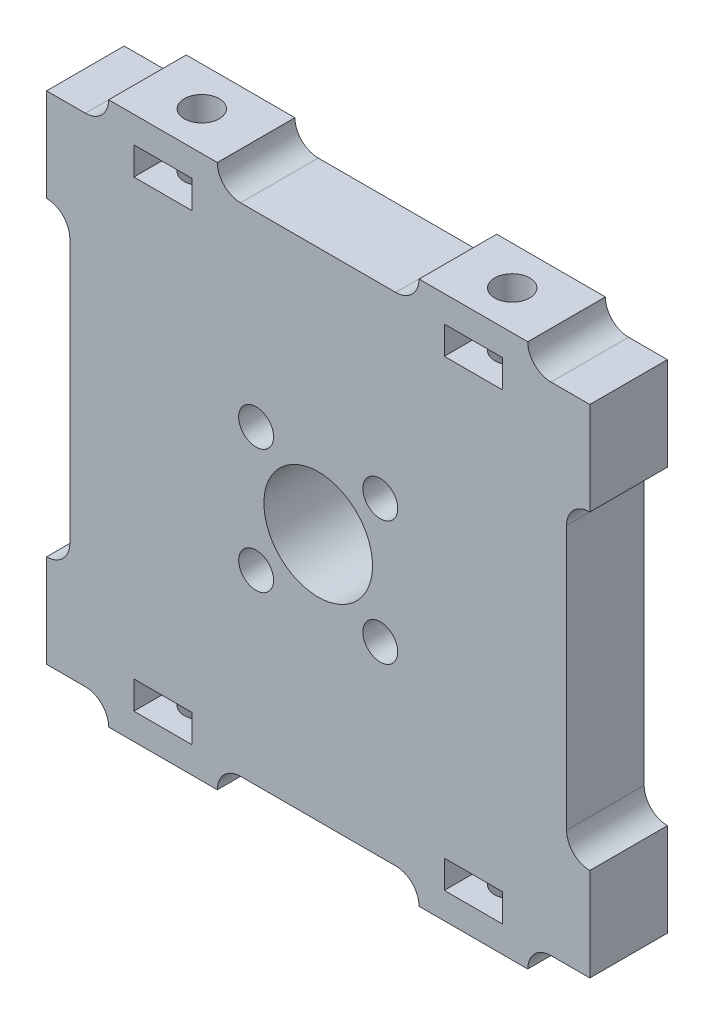
from build123d import *

# Parameters (mm, degrees)
CROQUIS1_W              = 70
CROQUIS1_H              = 70
CROQUIS1_R              = 7
SALIENTE_EXTRUIR1_DEPTH = 5
CROQUIS2_R              = 2.25
CROQUIS2_W              = 26
CROQUIS2_H              = 6
CROQUIS2_W_2            = 6
CROQUIS2_H_2            = 26
CORTAR_EXTRUIR1_DEPTH   = 51.497524692
CROQUIS4_R              = 2.25
CORTAR_EXTRUIR2_DEPTH   = 10
CORTAR_EXTRUIR3_DEPTH   = 3.6
CROQUIS6_W              = 8
CROQUIS6_H              = 3
CROQUIS6_W_2            = 6
CROQUIS6_H_2            = 40
CORTAR_EXTRUIR4_DEPTH   = 51.497524692
REDONDEO1_R             = 3


with BuildPart() as part:
    # Croquis1 → Saliente-Extruir1 (new, symmetric)
    with BuildSketch(Plane.XY):
        Rectangle(CROQUIS1_W, CROQUIS1_H)
        Circle(CROQUIS1_R, mode=Mode.SUBTRACT)
    extrude(amount=SALIENTE_EXTRUIR1_DEPTH, both=True)

    # Croquis2 → Cortar-Extruir1 (cut, through all)
    with BuildSketch(Plane.XY.offset(5)):
        with Locations((8, 8)):
            Circle(CROQUIS2_R)
        with Locations((8, -8)):
            Circle(CROQUIS2_R)
        with Locations((-8, -8)):
            Circle(CROQUIS2_R)
        with Locations((-8, 8)):
            Circle(CROQUIS2_R)
        with Locations((0, 35)):
            Rectangle(CROQUIS2_W, CROQUIS2_H)
        with Locations((-35, 0)):
            Rectangle(CROQUIS2_W_2, CROQUIS2_H_2)
        with Locations((35, 0)):
            Rectangle(CROQUIS2_W_2, CROQUIS2_H_2)
        with Locations((0, -35)):
            Rectangle(CROQUIS2_W, CROQUIS2_H)
    extrude(amount=-CORTAR_EXTRUIR1_DEPTH, mode=Mode.SUBTRACT)

    # Croquis4 → Cortar-Extruir2 (cut)
    with BuildSketch(Plane(origin=(0, 35, 0), x_dir=(1, 0, 0), z_dir=(0, 1, 0))):
        with Locations(Location((-20, 0, 0), (0, 0, 270))):
            Circle(CROQUIS4_R)
        with Locations(Location((20, 0, 0), (0, 0, 270))):
            Circle(CROQUIS4_R)
    cortar_extruir2 = extrude(amount=-CORTAR_EXTRUIR2_DEPTH, mode=Mode.SUBTRACT)

    # Croquis5 → Cortar-Extruir3 (cut)
    with BuildSketch(Plane(origin=(0, 28, 0), x_dir=(1, 0, 0), z_dir=(0, 1, 0))):
        Polygon((-23.75, -2.165063509), (-23.75, -5), (-16.25, -5), (-16.25, -2.165063509), (-16.25, 2.165063509), (-20, 4.330127019), (-23.75, 2.165063509), align=None)
        Polygon((16.25, 2.165063509), (16.25, -2.165063509), (16.25, -5), (23.75, -5), (23.75, -2.165063509), (23.75, 2.165063509), (20, 4.330127019), align=None)
    cortar_extruir3 = extrude(amount=CORTAR_EXTRUIR3_DEPTH, mode=Mode.SUBTRACT)

    # Simetría1: Cortar-Extruir2, Cortar-Extruir3 across plane
    add(cortar_extruir2.mirror(Plane.ZX), mode=Mode.SUBTRACT)
    add(cortar_extruir3.mirror(Plane.ZX), mode=Mode.SUBTRACT)

    # Croquis6 → Cortar-Extruir4 (cut, through all)
    with BuildSketch(Plane.XY.offset(5)):
        with Locations((-31, 33.5)):
            Rectangle(CROQUIS6_W, CROQUIS6_H)
        with Locations((31, 33.5)):
            Rectangle(CROQUIS6_W, CROQUIS6_H)
        with Locations((31, -33.5)):
            Rectangle(CROQUIS6_W, CROQUIS6_H)
        with Locations((-31, -33.5)):
            Rectangle(CROQUIS6_W, CROQUIS6_H)
        with Locations((-35, 0)):
            Rectangle(CROQUIS6_W_2, CROQUIS6_H_2)
        with Locations((35, 0)):
            Rectangle(CROQUIS6_W_2, CROQUIS6_H_2)
    extrude(amount=-CORTAR_EXTRUIR4_DEPTH, mode=Mode.SUBTRACT)

    # Redondeo1
    redondeo1_edges = [part.edges().sort_by_distance(p)[0] for p in [
        (27, -32, 0),
        (13, -32, 0),
        (-13, -32, 0),
        (-27, -32, 0),
        (-32, -20, 0),
        (-32, 20, 0),
        (32, -20, 0),
        (32, 20, 0),
        (27, 32, 0),
        (13, 32, 0),
        (-27, 32, 0),
        (-13, 32, 0),
    ]]
    fillet(redondeo1_edges, radius=REDONDEO1_R - 0.0001)  # a hair under: the kernel refuses the full size


solid = part.part
